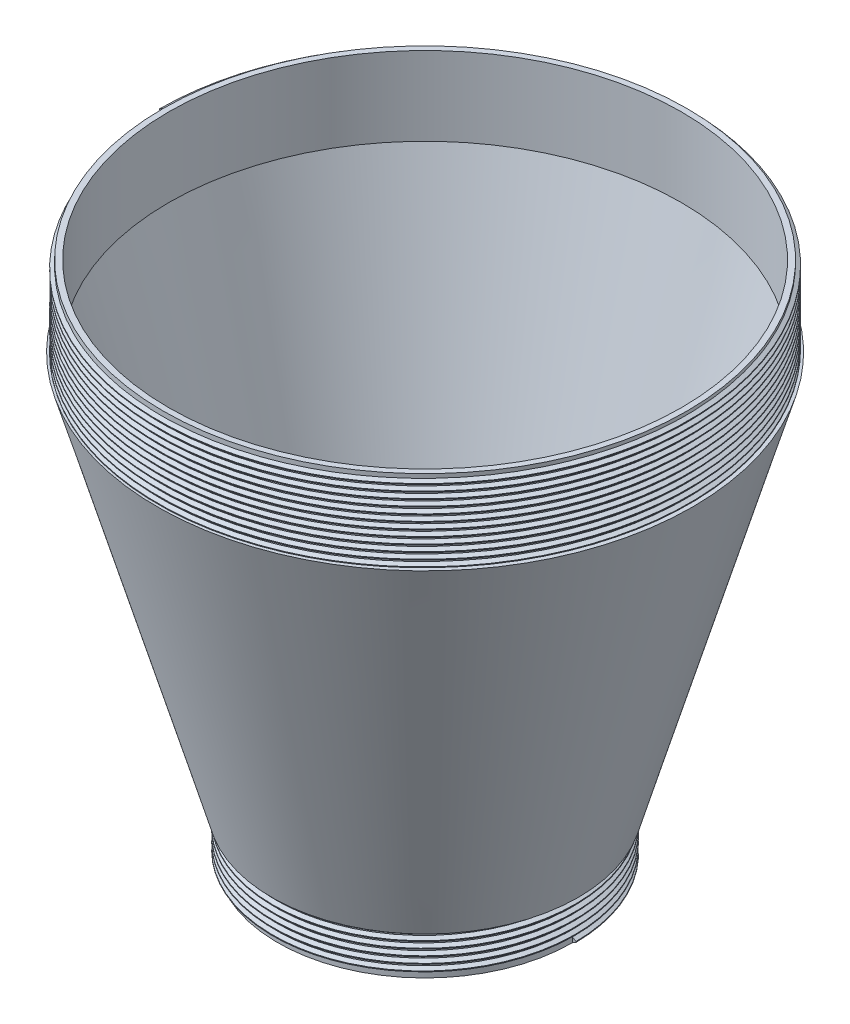
from build123d import *

# Parameters (mm, degrees)
THREAD1_PITCH = 1.5
THREAD2_PITCH = 1.5


with BuildPart() as part:
    # Sketch1 → Revolve1 (revolve)
    with BuildSketch(Plane.XY, mode=Mode.PRIVATE) as revolve1_sk:
        Polygon((-35.1, -40.041653069), (-61.3, 50.517321357), (-60, 50.517321357), (-60, 68.885872633), (-58.7, 68.885872633), (-58.7, 50.885872633), (-32.5, -39.673101793), (-32.5, -39.708823405), (-32.5, -49.708823405), (-33.75, -49.708823405), (-33.75, -40.034347268), (-35.1, -40.034347268), align=None)
    revolve(revolve1_sk.sketch.rotate(Axis((0, -1000, 0), (0, 1, 0)), 180), axis=Axis((0, -1000, 0), (0, 1, 0)))

    # Thread1: the profile of Thread Profile1 profile screwed along a right-hand helix of 6.449651 turns, 8 arcs to a turn; built about Z, then put on its axis
    thread1_z = Axis((0, 0, 0), (0, 0, 1))
    thread1_corners = [(33.7497, 0, -0.000173205), (34.561898813, 0, 0.468749998), (34.561898813, 0, 0.656249998), (33.7497, 0, 1.125173201)]
    with BuildLine(mode=Mode.PRIVATE) as thread1_profile:
        Line(thread1_corners[0], thread1_corners[1])
        Line(thread1_corners[1], thread1_corners[2])
        Line(thread1_corners[2], thread1_corners[3])
        Line(thread1_corners[3], thread1_corners[0])
    thread1_cap = Face(thread1_profile.wire())
    thread1_turn_angles = [0, 22.5, 45, 67.5, 90, 112.5, 135, 157.5, 180, 202.5, 225, 247.5, 270, 292.5, 315, 337.5, 360]
    thread1_turn_weights = [1, 0.9238795325112867, 1, 0.9238795325112867, 1, 0.9238795325112867, 1, 0.9238795325112867, 1, 0.9238795325112867, 1, 0.9238795325112867, 1, 0.9238795325112867, 1, 0.9238795325112867, 1]
    thread1_turn_rails = [Edge.make_bspline([Vector(p[0], p[1], 0).rotate(thread1_z, thread1_turn_angles[k]) / thread1_turn_weights[k] + Vector(0, 0, p[2] + THREAD1_PITCH * thread1_turn_angles[k] / 360) for k in range(17)], [0, 0, 0, 1, 1, 2, 2, 3, 3, 4, 4, 5, 5, 6, 6, 7, 7, 8, 8, 8], 2, thread1_turn_weights) for p in thread1_corners]
    thread1_turn_sides = [Face.make_surface_from_curves(thread1_turn_rails[p[0]], thread1_turn_rails[p[1]]) for p in [(0, 1), (1, 2), (2, 3), (3, 0)]]
    thread1_last_angles = [2160, 2182.5, 2205, 2227.5, 2250, 2272.5, 2295, 2308.4371365, 2321.874273]
    thread1_last_weights = [1, 0.9238795325112867, 1, 0.9238795325112867, 1, 0.9238795325112867, 1, 0.9726254655092086, 1]
    thread1_last_rails = [Edge.make_bspline([Vector(p[0], p[1], 0).rotate(thread1_z, thread1_last_angles[k]) / thread1_last_weights[k] + Vector(0, 0, p[2] + THREAD1_PITCH * thread1_last_angles[k] / 360) for k in range(9)], [0, 0, 0, 1, 1, 2, 2, 3, 3, 4, 4, 4], 2, thread1_last_weights) for p in thread1_corners]
    thread1_last_sides = [Face.make_surface_from_curves(thread1_last_rails[p[0]], thread1_last_rails[p[1]]) for p in [(0, 1), (1, 2), (2, 3), (3, 0)]]
    thread1 = Plane(origin=(0, -49.708823405, 0), x_dir=(1, 0, 0), z_dir=(0, 1, 0)) * Solid(Shell([*[p.moved(Location((0, 0, THREAD1_PITCH * i))) for i in range(6) for p in thread1_turn_sides], *thread1_last_sides, thread1_cap, thread1_cap.rotate(thread1_z, 2321.874273).moved(Location((0, 0, THREAD1_PITCH * 2321.874273 / 360)))]))
    add(thread1)

    # Thread2: the profile of Thread Profile2 profile screwed along a right-hand helix of 12.245701 turns, 8 arcs to a turn; built about Z, then put on its axis
    thread2_z = Axis((0, 0, 0), (0, 0, 1))
    thread2_corners = [(59.9997, 0, -0.000173205), (60.811898813, 0, 0.468749998), (60.811898813, 0, 0.656249998), (59.9997, 0, 1.125173201)]
    with BuildLine(mode=Mode.PRIVATE) as thread2_profile:
        Line(thread2_corners[0], thread2_corners[1])
        Line(thread2_corners[1], thread2_corners[2])
        Line(thread2_corners[2], thread2_corners[3])
        Line(thread2_corners[3], thread2_corners[0])
    thread2_cap = Face(thread2_profile.wire())
    thread2_turn_angles = [0, 22.5, 45, 67.5, 90, 112.5, 135, 157.5, 180, 202.5, 225, 247.5, 270, 292.5, 315, 337.5, 360]
    thread2_turn_weights = [1, 0.9238795325112867, 1, 0.9238795325112867, 1, 0.9238795325112867, 1, 0.9238795325112867, 1, 0.9238795325112867, 1, 0.9238795325112867, 1, 0.9238795325112867, 1, 0.9238795325112867, 1]
    thread2_turn_rails = [Edge.make_bspline([Vector(p[0], p[1], 0).rotate(thread2_z, thread2_turn_angles[k]) / thread2_turn_weights[k] + Vector(0, 0, p[2] + THREAD2_PITCH * thread2_turn_angles[k] / 360) for k in range(17)], [0, 0, 0, 1, 1, 2, 2, 3, 3, 4, 4, 5, 5, 6, 6, 7, 7, 8, 8, 8], 2, thread2_turn_weights) for p in thread2_corners]
    thread2_turn_sides = [Face.make_surface_from_curves(thread2_turn_rails[p[0]], thread2_turn_rails[p[1]]) for p in [(0, 1), (1, 2), (2, 3), (3, 0)]]
    thread2_last_angles = [4320, 4342.5, 4365, 4386.726153088, 4408.452306176]
    thread2_last_weights = [1, 0.9238795325112867, 1, 0.9289637010656756, 1]
    thread2_last_rails = [Edge.make_bspline([Vector(p[0], p[1], 0).rotate(thread2_z, thread2_last_angles[k]) / thread2_last_weights[k] + Vector(0, 0, p[2] + THREAD2_PITCH * thread2_last_angles[k] / 360) for k in range(5)], [0, 0, 0, 1, 1, 2, 2, 2], 2, thread2_last_weights) for p in thread2_corners]
    thread2_last_sides = [Face.make_surface_from_curves(thread2_last_rails[p[0]], thread2_last_rails[p[1]]) for p in [(0, 1), (1, 2), (2, 3), (3, 0)]]
    thread2 = Plane(origin=(0, 68.885872633, 0), x_dir=(-1, 0, 0), z_dir=(0, -1, 0)) * Solid(Shell([*[p.moved(Location((0, 0, THREAD2_PITCH * i))) for i in range(12) for p in thread2_turn_sides], *thread2_last_sides, thread2_cap, thread2_cap.rotate(thread2_z, 4408.452306176).moved(Location((0, 0, THREAD2_PITCH * 4408.452306176 / 360)))]))
    add(thread2)


solid = part.part
